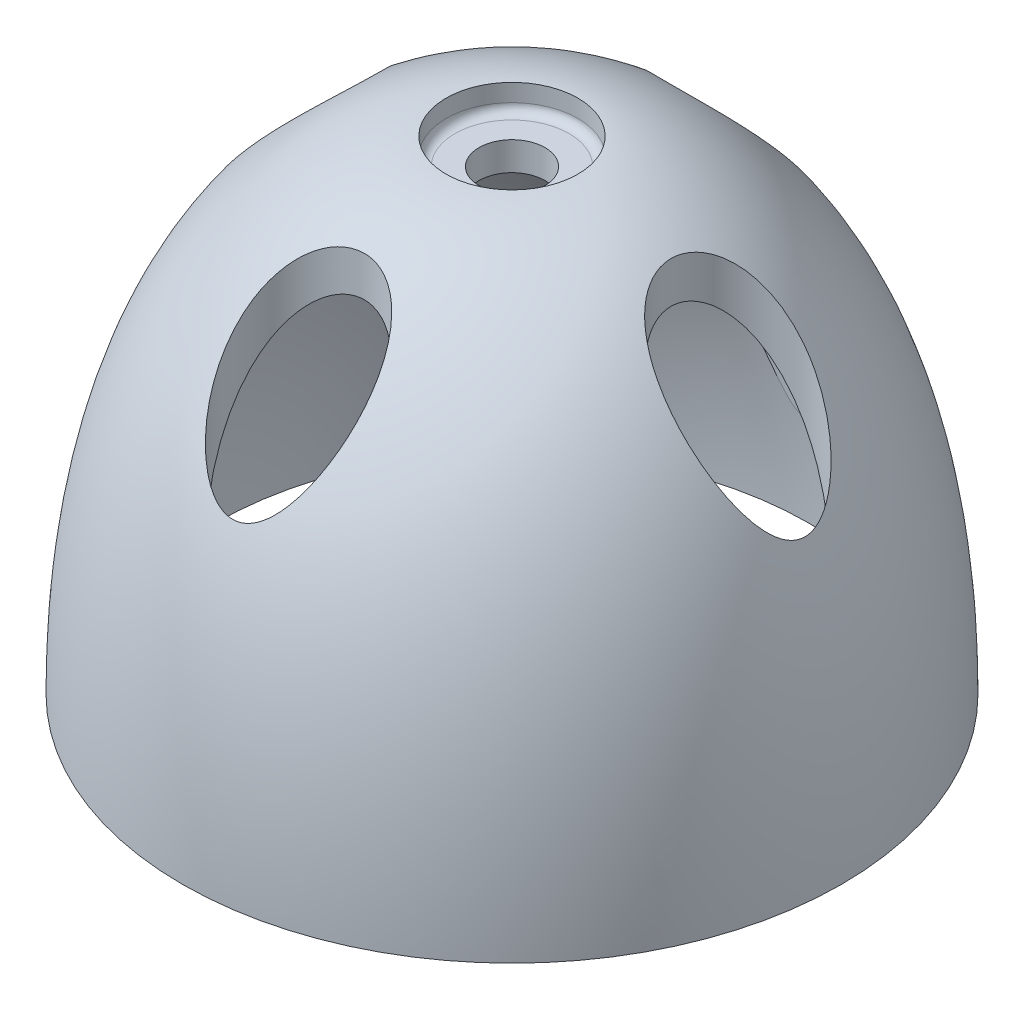
from build123d import *


with BuildPart() as part:
    # Эскиз1 → Повернуть1 (revolve)
    with BuildSketch(Plane.XY, mode=Mode.PRIVATE) as revolve_1_sk:
        with BuildLine():
            Line((13.5, 0), (15, 0))
            add(Edge.make_bspline(
                [(15, 0), (15, 16.570601506), (7.173616496, 21.744270336), (3, 22)],
                knots=[0, 0, 0, 0, 1, 1, 1, 1], degree=3))
            Line((3, 22), (3, 21.2))
            ThreePointArc((3, 21.2), (2.882842712, 20.917157288), (2.6, 20.8))
            Line((2.6, 20.8), (1.5, 20.8))
            Line((1.5, 20.8), (1.5, 19.5))
            Line((1.5, 19.5), (3, 19.5))
            Line((3, 19.5), (3, 20))
            Line((3, 20), (4.5, 20))
            add(Edge.make_bspline(
                [(13.5, 0), (13.5, 14.873035427), (6.285064211, 19.96483175), (4.5, 20)],
                knots=[0, 0, 0, 0, 1, 1, 1, 1], degree=3))
        make_face()
    revolve(revolve_1_sk.sketch.rotate(Axis((0, 0, 0), (0, 1, 0)), 90), axis=Axis((0, 0, 0), (0, 1, 0)))

    # Вырез-Вытянуть2: read off the stored shape, not the designer's step
    # Вырез-Вытянуть2: loft between two sections, ruled curve by curve
    cut_extrude_2_from = [
        Edge.make_three_point_arc((10, 20.557685128, -3.282641035), (13, 20.557685128, -0.282641035), (10, 20.557685128, 2.717358965)),
        Edge.make_three_point_arc((10, 20.557685128, 2.717358965), (7, 20.557685128, -0.282641035), (10, 20.557685128, -3.282641035)),
    ]
    cut_extrude_2_to = [
        Edge.make_three_point_arc((10, 6.366915716, -3.282641035), (13, 6.366915716, -0.282641035), (10, 6.366915716, 2.717358965)),
        Edge.make_three_point_arc((10, 6.366915716, 2.717358965), (7, 6.366915716, -0.282641035), (10, 6.366915716, -3.282641035)),
    ]
    cut_extrude_2 = Solid(Shell([*[Face.make_surface_from_curves(cut_extrude_2_from[k], cut_extrude_2_to[k]) for k in range(2)], Face(Wire(cut_extrude_2_from)), Face(Wire(cut_extrude_2_to))]))
    add(cut_extrude_2, mode=Mode.SUBTRACT)

    # Cut-Extrude 2 2: loft between two sections, ruled curve by curve
    cut_extrude_2_2_from = [
        Edge.make_three_point_arc((0, 20.371865001, -13.282641035), (3, 20.371865001, -10.282641035), (0, 20.371865001, -7.282641035)),
        Edge.make_three_point_arc((0, 20.371865001, -7.282641035), (-3, 20.371865001, -10.282641035), (0, 20.371865001, -13.282641035)),
    ]
    cut_extrude_2_2_to = [
        Edge.make_three_point_arc((0, 4.304185555, -13.282641035), (3, 4.304185555, -10.282641035), (0, 4.304185555, -7.282641035)),
        Edge.make_three_point_arc((0, 4.304185555, -7.282641035), (-3, 4.304185555, -10.282641035), (0, 4.304185555, -13.282641035)),
    ]
    cut_extrude_2_2 = Solid(Shell([*[Face.make_surface_from_curves(cut_extrude_2_2_from[k], cut_extrude_2_2_to[k]) for k in range(2)], Face(Wire(cut_extrude_2_2_from)), Face(Wire(cut_extrude_2_2_to))]))
    add(cut_extrude_2_2, mode=Mode.SUBTRACT)

    # Cut-Extrude 2 3: loft between two sections, ruled curve by curve
    cut_extrude_2_3_from = [
        Edge.make_three_point_arc((-10, 20.557693397, -3.282641035), (-7, 20.557693397, -0.282641035), (-10, 20.557693397, 2.717358965)),
        Edge.make_three_point_arc((-10, 20.557693397, 2.717358965), (-13, 20.557693397, -0.282641035), (-10, 20.557693397, -3.282641035)),
    ]
    cut_extrude_2_3_to = [
        Edge.make_three_point_arc((-10, 6.366921079, -3.282641035), (-7, 6.366921079, -0.282641035), (-10, 6.366921079, 2.717358965)),
        Edge.make_three_point_arc((-10, 6.366921079, 2.717358965), (-13, 6.366921079, -0.282641035), (-10, 6.366921079, -3.282641035)),
    ]
    cut_extrude_2_3 = Solid(Shell([*[Face.make_surface_from_curves(cut_extrude_2_3_from[k], cut_extrude_2_3_to[k]) for k in range(2)], Face(Wire(cut_extrude_2_3_from)), Face(Wire(cut_extrude_2_3_to))]))
    add(cut_extrude_2_3, mode=Mode.SUBTRACT)

    # Cut-Extrude 2 4: loft between two sections, ruled curve by curve
    cut_extrude_2_4_from = [
        Edge.make_three_point_arc((0, 20.736172935, 6.717358965), (3, 20.736172935, 9.717358965), (0, 20.736172935, 12.717358965)),
        Edge.make_three_point_arc((0, 20.736172935, 12.717358965), (-3, 20.736172935, 9.717358965), (0, 20.736172935, 6.717358965)),
    ]
    cut_extrude_2_4_to = [
        Edge.make_three_point_arc((0, 7.869738173, 6.717358965), (3, 7.869738173, 9.717358965), (0, 7.869738173, 12.717358965)),
        Edge.make_three_point_arc((0, 7.869738173, 12.717358965), (-3, 7.869738173, 9.717358965), (0, 7.869738173, 6.717358965)),
    ]
    cut_extrude_2_4 = Solid(Shell([*[Face.make_surface_from_curves(cut_extrude_2_4_from[k], cut_extrude_2_4_to[k]) for k in range(2)], Face(Wire(cut_extrude_2_4_from)), Face(Wire(cut_extrude_2_4_to))]))
    add(cut_extrude_2_4, mode=Mode.SUBTRACT)


solid = part.part
